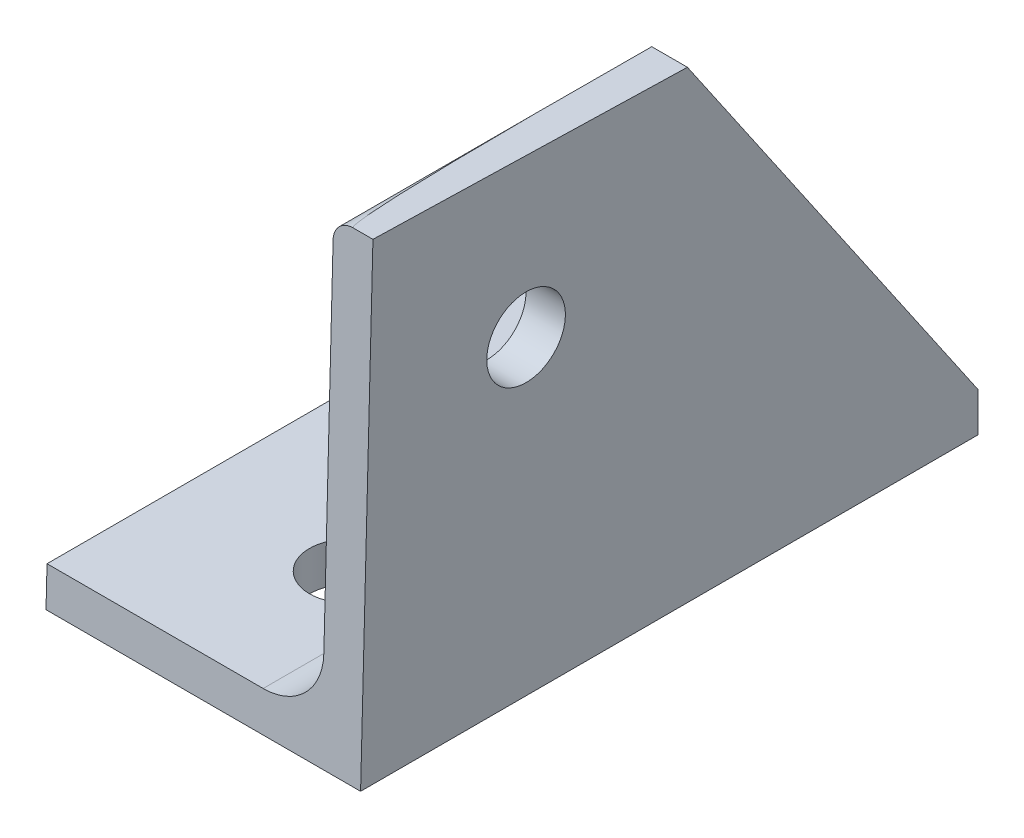
from build123d import *

# Parameters (mm, degrees)
BOSS_EXTRUDE1_DEPTH = 25.4
SKETCH3_R           = 3.175
SKETCH3_W           = 12.7
SKETCH3_H           = 50.8
CUT_EXTRUDE1_DEPTH  = 50.595085442
SKETCH12_OUTSIDE_W  = 66.478
SKETCH12_OUTSIDE_H  = 53.778
CUT_EXTRUDE2_DEPTH  = 41.659838908
SKETCH13_R          = 3.175
CUT_EXTRUDE3_DEPTH  = 41.659838908


with BuildPart() as part:
    # Sketch2 → Boss-Extrude1 (new, symmetric)
    with BuildSketch(Plane.XY):
        with BuildLine():
            Line((-19.05, -19.05), (19.05, -19.05))
            Line((19.05, -19.05), (19.05, 19.05))
            Line((19.05, 19.05), (17.4625, 19.05))
            ThreePointArc((17.4625, 19.05), (16.339967985, 18.585032015), (15.875, 17.4625))
            Line((15.875, 17.4625), (15.875, -11.0998))
            ThreePointArc((15.875, -11.0998), (14.476376302, -14.476376302), (11.0998, -15.875))
            Line((11.0998, -15.875), (-17.4625, -15.875))
            ThreePointArc((-17.4625, -15.875), (-18.585032015, -16.339967985), (-19.05, -17.4625))
            Line((-19.05, -17.4625), (-19.05, -19.05))
        make_face()
    extrude(amount=BOSS_EXTRUDE1_DEPTH, both=True)

    # Sketch3 → Cut-Extrude1 (cut, through all)
    with BuildSketch(Plane.XZ.offset(19.05)):
        with Locations((6.35, 12.7)):
            Circle(SKETCH3_R)
        with Locations((6.35, -12.7)):
            Circle(SKETCH3_R)
        with Locations((-12.7, 0)):
            Rectangle(SKETCH3_W, SKETCH3_H)
    extrude(amount=-CUT_EXTRUDE1_DEPTH, mode=Mode.SUBTRACT)

    # Sketch12 outside → Cut-Extrude2 (cut, through all)
    with BuildSketch(Plane(origin=(19.05, 0, 0), x_dir=(0, 0, -1), z_dir=(1, 0, 0))):
        Rectangle(SKETCH12_OUTSIDE_W, SKETCH12_OUTSIDE_H)
        Polygon((25.4, -19.05), (-24.449518438, -19.05), (-23.451834826, 19.05), (1.939461228, 18.385105513), (25.4, -15.875), align=None, mode=Mode.SUBTRACT)
    extrude(amount=-CUT_EXTRUDE2_DEPTH, mode=Mode.SUBTRACT)

    # Sketch13 → Cut-Extrude3 (cut, through all)
    with BuildSketch(Plane(origin=(19.05, 0, 0), x_dir=(0, 0, -1), z_dir=(1, 0, 0))):
        with Locations((-11.088634042, 6.021904729)):
            Circle(SKETCH13_R)
    extrude(amount=-CUT_EXTRUDE3_DEPTH, mode=Mode.SUBTRACT)


solid = part.part
